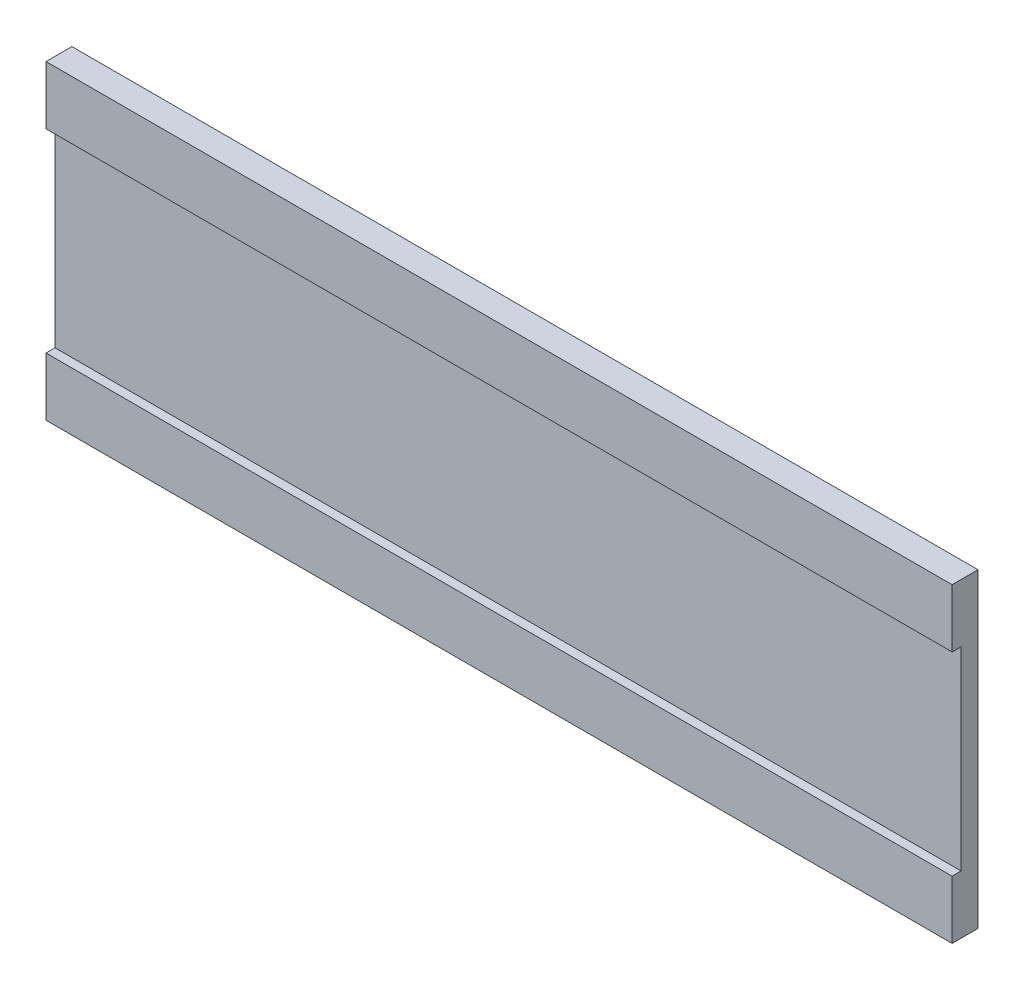
from build123d import *

# Parameters (mm, degrees)
ESQUISSE1_W             = 140
ESQUISSE1_H             = 48
BOSS_EXTRU_1_DEPTH      = 4
ESQUISSE2_W             = 1.390122209
ESQUISSE2_H             = 30
ENL_V_MAT_EXTRU_1_DEPTH = 143.438941859


with BuildPart() as part:
    # Esquisse1 → Boss.-Extru.1 (new body)
    with BuildSketch(Plane.XY):
        with Locations((36.441041546, 1.939393939)):
            Rectangle(ESQUISSE1_W, ESQUISSE1_H)
    extrude(amount=BOSS_EXTRU_1_DEPTH)

    # Esquisse2 → Enlèv. mat.-Extru.1 (cut, through all)
    with BuildSketch(Plane.ZY.offset(33.558958454)):
        with Locations((3.304938896, 1.939393939)):
            Rectangle(ESQUISSE2_W, ESQUISSE2_H)
    extrude(amount=-ENL_V_MAT_EXTRU_1_DEPTH, mode=Mode.SUBTRACT)


solid = part.part
